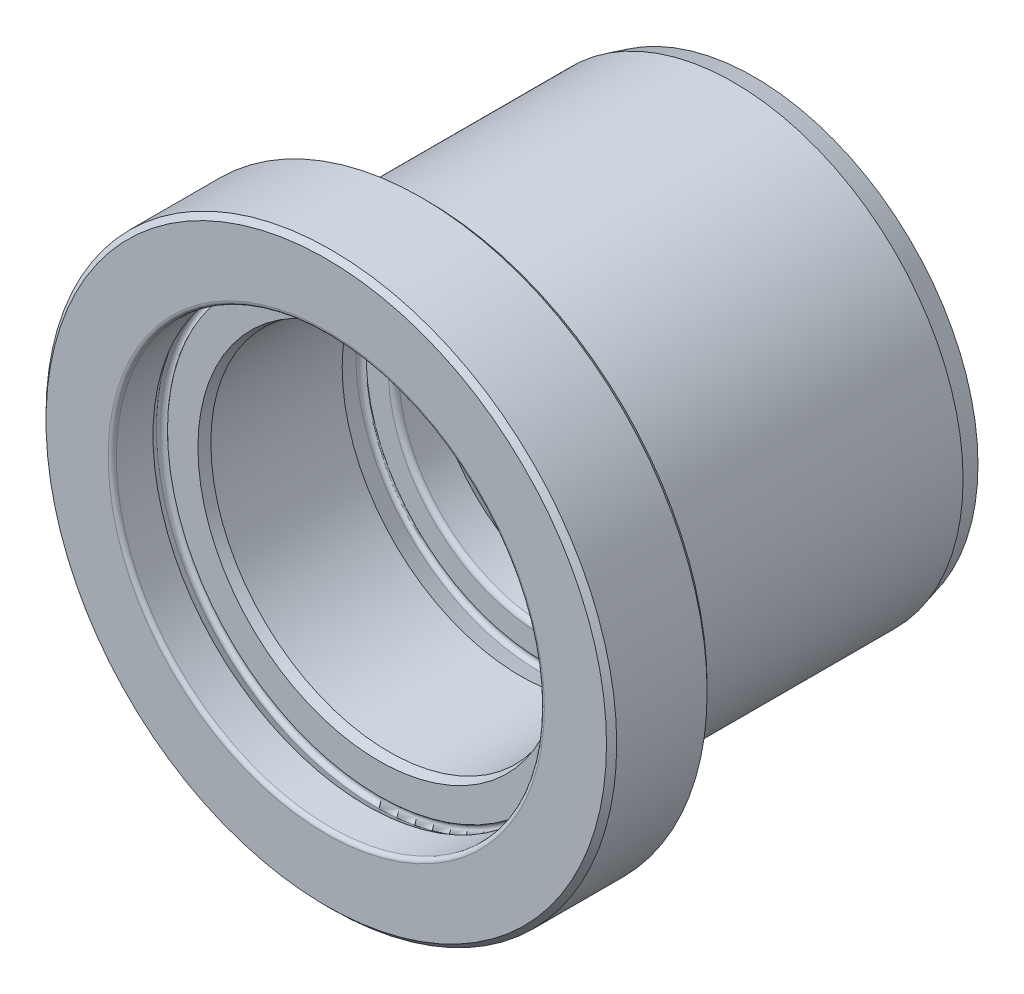
from build123d import *


with BuildPart() as part:
    # Sketch1 → Revolve1 (revolve)
    with BuildSketch(Plane(origin=(0, 0, 0), x_dir=(0, 0, -1), z_dir=(1, 0, 0))):
        with BuildLine():
            Line((0, 27.5025), (0, 21.4025))
            ThreePointArc((0, 21.4025), (0.117157288, 21.119657288), (0.4, 21.0025))
            Line((0.4, 21.0025), (4, 21.0025))
            Line((4, 21.0025), (4.776188096, 21.447093398))
            ThreePointArc((4.776188096, 21.447093398), (5.321752289, 21.299406245), (5.175, 20.753589838))
            Line((5.175, 20.753589838), (5.175, 17.770449192))
            Line((5.175, 17.770449192), (6.175, 17.5025))
            Line((6.175, 17.5025), (19.065643724, 17.5025))
            Line((19.065643724, 17.5025), (20.871472382, 17.986370331))
            ThreePointArc((20.871472382, 17.986370331), (21.344551813, 17.753073373), (21.175, 17.253589838))
            Line((21.175, 17.253589838), (21.175, 15.0925))
            ThreePointArc((21.175, 15.0925), (21.321446609, 14.738946609), (21.675, 14.5925))
            Line((21.675, 14.5925), (24.99, 14.5925))
            Line((24.99, 14.5925), (26.619855519, 15.730038226))
            ThreePointArc((26.619855519, 15.730038226), (27.576420826, 15.996790344), (28.49, 15.6075))
            Line((28.49, 15.6075), (37.0475, 15.6075))
            Line((37.0475, 15.6075), (38.94, 17.5))
            Line((38.94, 17.5), (38.94, 18.5375))
            ThreePointArc((38.94, 18.5375), (39.086446609, 18.891053391), (39.44, 19.0375))
            Line((39.44, 19.0375), (41.69, 19.0375))
            ThreePointArc((41.69, 19.0375), (41.902132034, 19.125367966), (41.99, 19.3375))
            Line((41.99, 19.3375), (41.99, 21.966601615))
            Line((41.99, 21.966601615), (39.99, 22.5025))
            Line((39.99, 22.5025), (11.90301653, 22.5025))
            Line((11.90301653, 22.5025), (10.078527618, 22.013629669))
            ThreePointArc((10.078527618, 22.013629669), (9.588161646, 22.298235133), (9.875, 22.787298335))
            Line((9.875, 22.787298335), (9.875, 27.5025))
            Line((9.875, 27.5025), (9.375, 28.0025))
            Line((9.375, 28.0025), (0.5, 28.0025))
            Line((0.5, 28.0025), (0, 27.5025))
        make_face()
    revolve(axis=Axis((0, 0, 0), (0, 0, -1)))


solid = part.part
